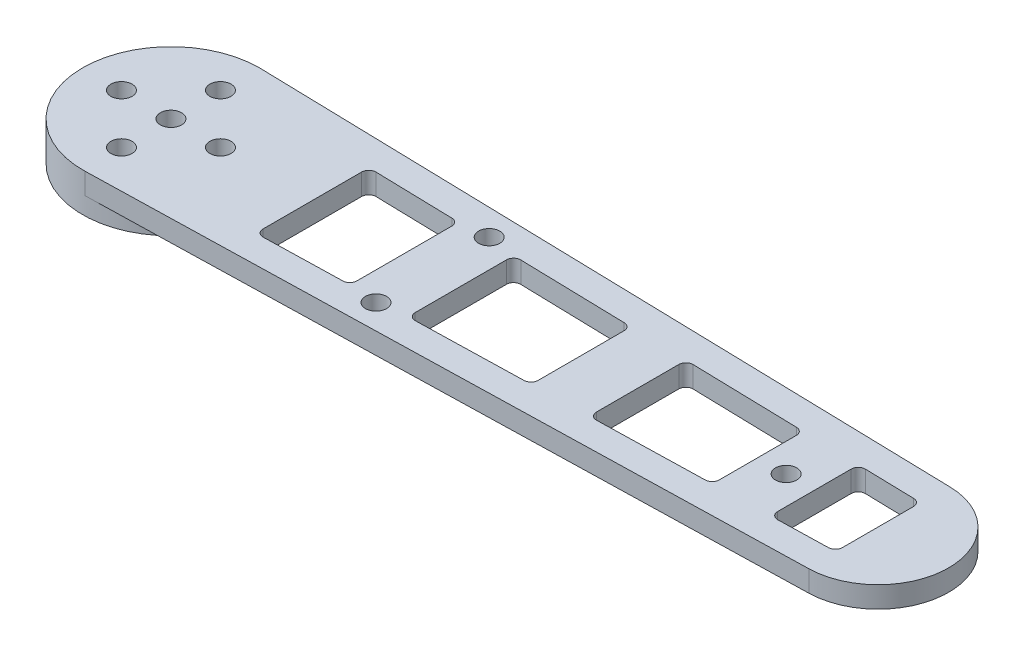
from build123d import *

# Parameters (mm, degrees)
SKETCH_1_R          = 1.5
EXTRUDE_1_DEPTH     = 3
EXTRUDE_START       = 2.5
SKETCH_2_R          = 12.5
SKETCH_2_R_2        = 10
EXTRUDE_2_DEPTH     = 2.5
SKETCH_3_R          = 1.5
CUT_EXTRUDE_1_DEPTH = 10
FILLET_1_R          = 1


with BuildPart() as part:
    # 草图1 → 凸台-拉伸1 (new body)
    with BuildSketch(Plane(origin=(0, 0, 0), x_dir=(1, 0, 0), z_dir=(0, 1, 0))):
        with BuildLine():
            ThreePointArc((0.3125, 12.496093139), (-12.5, 0), (0.3125, -12.496093139))
            Line((0.3125, -12.496093139), (100.25, -9.996874512))
            ThreePointArc((100.25, -9.996874512), (110, 0), (100.25, 9.996874512))
            Line((100.25, 9.996874512), (0.3125, 12.496093139))
        make_face()
        with Locations((7, 0)):
            Circle(SKETCH_1_R, mode=Mode.SUBTRACT)
        Circle(SKETCH_1_R, mode=Mode.SUBTRACT)
        with Locations((-7, 0)):
            Circle(SKETCH_1_R, mode=Mode.SUBTRACT)
        with Locations((0, 7)):
            Circle(SKETCH_1_R, mode=Mode.SUBTRACT)
        with Locations((0, -7)):
            Circle(SKETCH_1_R, mode=Mode.SUBTRACT)
    extrude(amount=EXTRUDE_1_DEPTH)

    # 草图2 → 凸台-拉伸2 (add)
    with BuildSketch(Plane.XZ.offset(EXTRUDE_START)):
        Circle(SKETCH_2_R)
        Circle(SKETCH_2_R_2, mode=Mode.SUBTRACT)
    extrude(amount=-EXTRUDE_2_DEPTH)

    # 草图3 → 切除-拉伸1 (cut)
    with BuildSketch(Plane(origin=(0, 3, 0), x_dir=(1, 0, 0), z_dir=(0, 1, 0))):
        Polygon((20, 8.002501172), (20, -8.002501172), (33, -7.677399562), (33, 7.677399562), align=None)
        Polygon((41, 7.477337033), (41, -7.477337033), (58, -7.052204158), (58, 7.052204158), align=None)
        with Locations((37, 8)):
            Circle(SKETCH_3_R)
        with Locations((37, -8)):
            Circle(SKETCH_3_R)
        Polygon((66, 6.852141629), (66, -6.852141629), (83, -6.427008754), (83, 6.427008754), align=None)
        with Locations((87, 0)):
            Circle(SKETCH_3_R)
        Polygon((91, 6.226946225), (91, -6.226946225), (100, -6.001875879), (100, 6.001875879), align=None)
    extrude(amount=-CUT_EXTRUDE_1_DEPTH, mode=Mode.SUBTRACT)

    # 圆角1
    fillet_1_edges = [part.edges().sort_by_distance(p)[0] for p in [
        (100, 1.5, 6.001875879),
        (91, 1.5, -6.226946225),
        (100, 1.5, -6.001875879),
        (91, 1.5, 6.226946225),
        (66, 1.5, 6.852141629),
        (83, 1.5, 6.427008754),
        (83, 1.5, -6.427008754),
        (66, 1.5, -6.852141629),
        (41, 1.5, 7.477337033),
        (41, 1.5, -7.477337033),
        (58, 1.5, -7.052204158),
        (58, 1.5, 7.052204158),
        (33, 1.5, 7.677399562),
        (33, 1.5, -7.677399562),
        (20, 1.5, 8.002501172),
        (20, 1.5, -8.002501172),
    ]]
    fillet(fillet_1_edges, radius=FILLET_1_R)


solid = part.part
